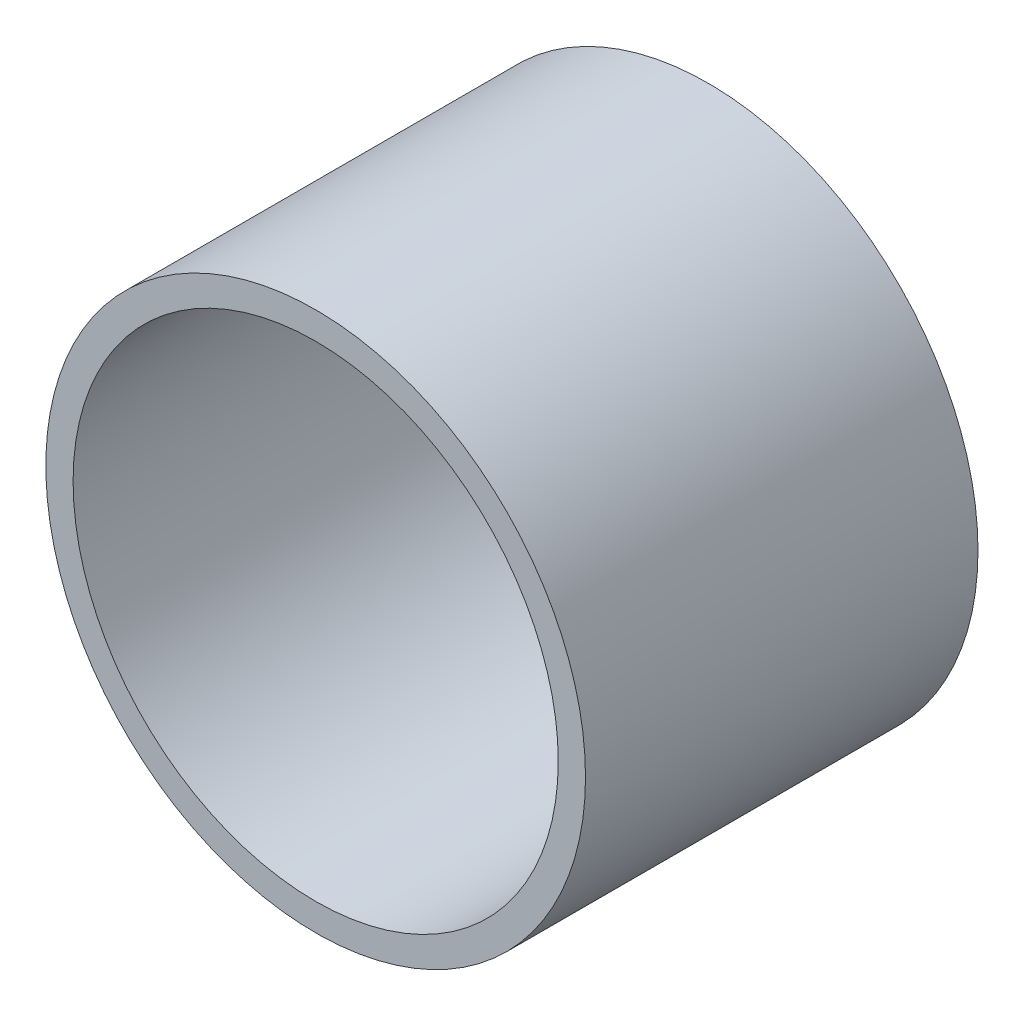
from build123d import *

# Parameters (mm, degrees)
SKETCH1_R           = 25.146
SKETCH1_R_2         = 22.606
BOSS_EXTRUDE1_DEPTH = 36.576


with BuildPart() as part:
    # Sketch1 → Boss-Extrude1 (new body)
    with BuildSketch(Plane.XY):
        Circle(SKETCH1_R)
        Circle(SKETCH1_R_2, mode=Mode.SUBTRACT)
    extrude(amount=BOSS_EXTRUDE1_DEPTH)


solid = part.part
